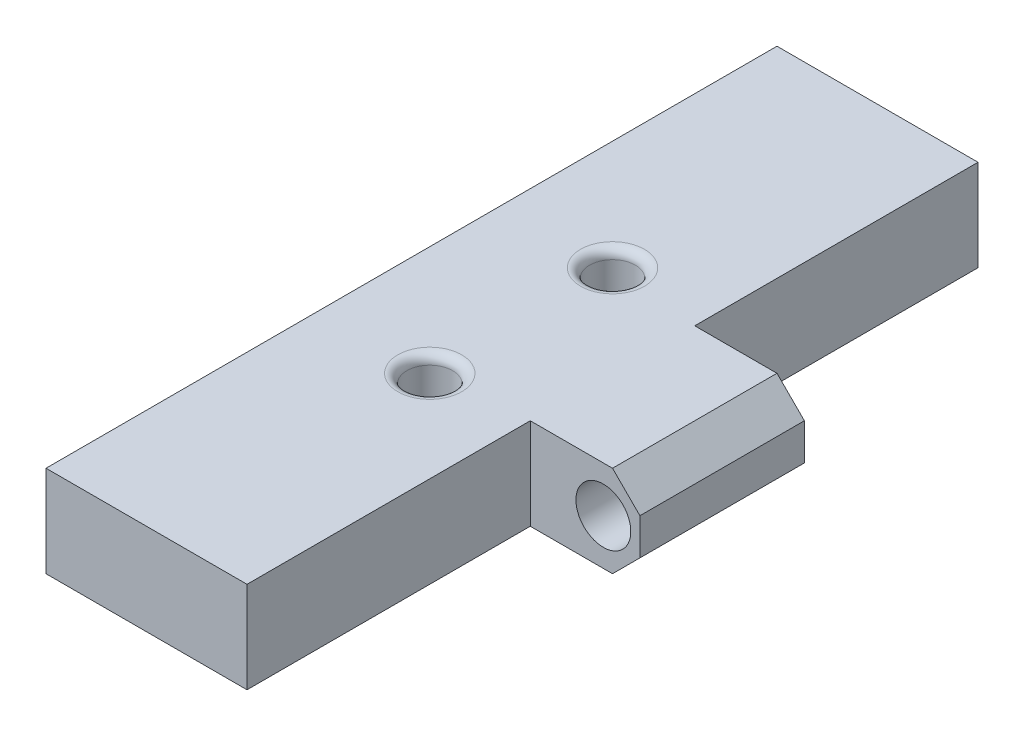
from build123d import *

# Parameters (mm, degrees)
SKETCH1_W             = 12
SKETCH1_H             = 40
SKETCH1_R             = 1.25
HINGE_DEPTH           = 5
SKETCH4_W             = 9
SKETCH4_H             = 5
HINGE_EXTRUDE_2_DEPTH = 5
SKETCH15_W            = 15.5
SKETCH15_H            = 5
CUT_AWAY_2_DEPTH      = 1
SKETCH6_R             = 1.5
HOLE_CUT_2_DEPTH      = 28.317576759
CHAMFER2_SIZE         = 1.5
FILLET_HOLES_2_R      = 0.5


with BuildPart() as part:
    # Sketch1 → Hinge (new body)
    with BuildSketch(Plane(origin=(0, 0, 0), x_dir=(1, 0, 0), z_dir=(0, 1, 0))):
        Rectangle(SKETCH1_W, SKETCH1_H)
        with Locations((0, 5)):
            Circle(SKETCH1_R, mode=Mode.SUBTRACT)
        with Locations((0, -5)):
            Circle(SKETCH1_R, mode=Mode.SUBTRACT)
    extrude(amount=HINGE_DEPTH)

    # Sketch4 → Hinge Extrude 2 (add)
    with BuildSketch(Plane(origin=(6, 0, 0), x_dir=(0, 0, -1), z_dir=(1, 0, 0))):
        with Locations((0, 2.5)):
            Rectangle(SKETCH4_W, SKETCH4_H)
    extrude(amount=HINGE_EXTRUDE_2_DEPTH)

    # Sketch15 → Cut Away 2 (cut)
    with BuildSketch(Plane(origin=(6, 0, 0), x_dir=(0, 0, -1), z_dir=(1, 0, 0))):
        with Locations((-12.25, 2.5)):
            Rectangle(SKETCH15_W, SKETCH15_H)
        with Locations((12.25, 2.5)):
            Rectangle(SKETCH15_W, SKETCH15_H)
    extrude(amount=-CUT_AWAY_2_DEPTH, mode=Mode.SUBTRACT)

    # Sketch6 → Hole Cut 2 (cut, through all)
    with BuildSketch(Plane(origin=(0, 0, -4.5), x_dir=(-1, 0, 0), z_dir=(0, 0, -1))):
        with Locations((-9, 2.5)):
            Circle(SKETCH6_R)
    extrude(amount=-HOLE_CUT_2_DEPTH, mode=Mode.SUBTRACT)

    # Chamfer2
    chamfer2_edges = [part.edges().sort_by_distance(p)[0] for p in [
        (11, 0, 0),
        (11, 5, 0),
    ]]
    chamfer(chamfer2_edges, length=CHAMFER2_SIZE)

    # Fillet Holes 2
    fillet_holes_2_edges = [part.edges().sort_by_distance(p)[0] for p in [
        (-1.25, 0, 5),
        (-1.25, 5, 5),
        (-1.25, 0, -5),
        (-1.25, 5, -5),
    ]]
    fillet(fillet_holes_2_edges, radius=FILLET_HOLES_2_R)


solid = part.part
